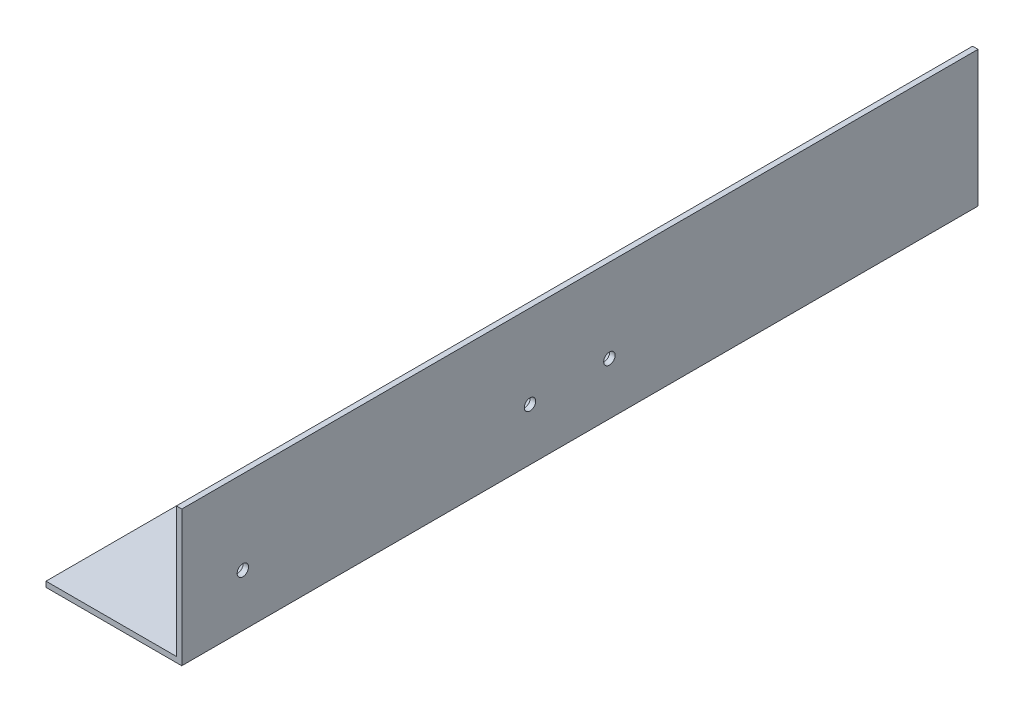
from build123d import *

# Parameters (mm, degrees)
BOSS_EXTRUDE1_DEPTH = 293.25
SKETCH2_R           = 2.1
CUT_EXTRUDE1_DEPTH  = 5
SKETCH3_R           = 2.75
CUT_EXTRUDE2_DEPTH  = 5


with BuildPart() as part:
    # Sketch1 → Boss-Extrude1 (new body)
    with BuildSketch(Plane.XY):
        Polygon((0, 0), (-50, 0), (-50, 2), (-2, 2), (-2, 50), (0, 50), align=None)
    extrude(amount=BOSS_EXTRUDE1_DEPTH)

    # Sketch2 → Cut-Extrude1 (cut, symmetric)
    with BuildSketch(Plane(origin=(0, 0, 0), x_dir=(0, 0, -1), z_dir=(1, 0, 0))):
        with Locations((-135.75, 19.25)):
            Circle(SKETCH2_R)
        with Locations((-165, 19.25)):
            Circle(SKETCH2_R)
        with Locations((-270.75, 19.25)):
            Circle(SKETCH2_R)
    extrude(amount=CUT_EXTRUDE1_DEPTH, both=True, mode=Mode.SUBTRACT)

    # Sketch3 → Cut-Extrude2 (cut, symmetric)
    with BuildSketch(Plane(origin=(0, 0, 0), x_dir=(1, 0, 0), z_dir=(0, 1, 0))):
        with Locations((-25, -12.5)):
            Circle(SKETCH3_R)
        with Locations((-25, -37.5)):
            Circle(SKETCH3_R)
    extrude(amount=CUT_EXTRUDE2_DEPTH, both=True, mode=Mode.SUBTRACT)


solid = part.part
